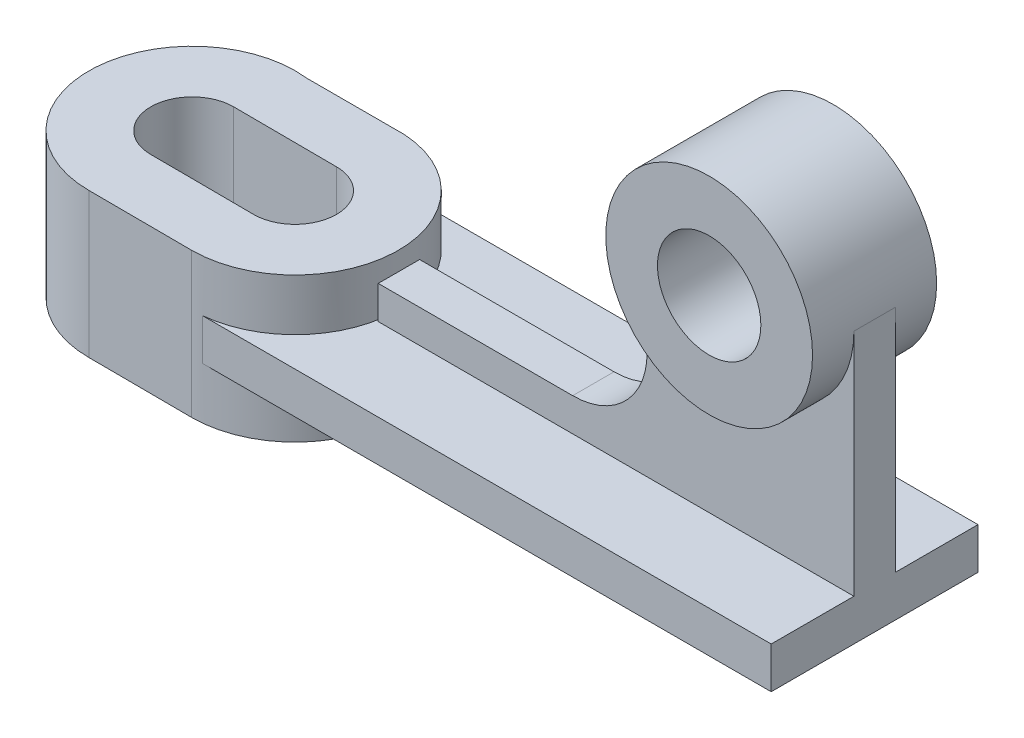
from build123d import *

# Parameters (mm, degrees)
SKETCH1_W                 = 140
SKETCH1_H                 = 50
BOSS_EXTRUDE1_DEPTH       = 10
BOSS_EXTRUDE2_START       = -12.5
BOSS_EXTRUDE2_DEPTH       = 35
CUT_EXTRUDE1_DEPTH        = 50
BOSS_EXTRUDE8_DEPTH       = 5
BOSS_EXTRUDE9_START       = -18.443977
BOSS_EXTRUDE9_OUTLINE_R   = 25
BOSS_EXTRUDE9_OUTLINE_R_2 = 12.5
BOSS_EXTRUDE9_DEPTH       = 30
FILLET1_R                 = 18
CUT_EXTRUDE2_START        = -30
CUT_EXTRUDE2_DEPTH        = 30


# Read off the part's stored shape, not the designer's step: Boss-Extrude2, Boss-Extrude9
with BuildPart() as part:
    # Sketch1 → Boss-Extrude1 (new body)
    with BuildSketch(Plane(origin=(0, 0, 0), x_dir=(1, 0, 0), z_dir=(0, 1, 0))):
        with Locations((17.140882, 3.443977)):
            Rectangle(SKETCH1_W, SKETCH1_H)
    extrude(amount=BOSS_EXTRUDE1_DEPTH)

    # Boss-Extrude2 outline → Boss-Extrude2 (add)
    with BuildSketch(Plane(origin=(0, 0, 0), x_dir=(1, 0, 0), z_dir=(0, 1, 0)).offset(BOSS_EXTRUDE2_START)):
        with BuildLine():
            Line((-51.363996, 28.275018), (-52.859118, 28.275018))
            Line((-52.859118, 28.275018), (-74.973336, 28.275018))
            ThreePointArc((-74.973336, 28.275018), (-102.814942, 4.885934), (-77.856685, -21.558151))
            Line((-77.856685, -21.558151), (-52.858882, -21.680248))
            ThreePointArc((-52.858882, -21.680248), (-27.870068, 2.571974), (-51.363996, 28.275018))
        make_face()
        with BuildLine():
            Line((-52.859118, 13.319754), (-52.858882, 13.319753))
            ThreePointArc((-52.858882, 13.319753), (-42.85888, 3.319752), (-52.858882, -6.68025))
            Line((-52.858882, -6.68025), (-52.859118, -6.680248))
            Line((-52.859118, -6.680248), (-77.856685, -6.558153))
            ThreePointArc((-77.856685, -6.558153), (-87.856686, 3.441849), (-77.856685, 13.44185))
            Line((-77.856685, 13.44185), (-52.859118, 13.319754))
        make_face(mode=Mode.SUBTRACT)
    extrude(amount=BOSS_EXTRUDE2_DEPTH)

    # Sketch2 → Cut-Extrude1 (cut)
    with BuildSketch(Plane(origin=(0, 10, 0), x_dir=(1, 0, 0), z_dir=(0, 1, 0))):
        with BuildLine():
            Line((-52.859118, 13.319753), (-52.859118, -6.68025))
            ThreePointArc((-52.859118, -6.68025), (-42.859116, 3.319752), (-52.859118, 13.319753))
        make_face()
    extrude(amount=-CUT_EXTRUDE1_DEPTH, mode=Mode.SUBTRACT)

    # 3DSketch2 → Boss-Extrude8 (add, symmetric)
    with BuildSketch(Plane(origin=(87.140882, 10, -3.443977), x_dir=(-0.9975892937431798, 0.0693945315495666, 0), z_dir=(0, 0, -1))):
        Polygon((0, 0), (114.733361, -7.981108), (115.288545, 0), (50.434648, 4.511381), (53.730889, 51.896873), (3.851424, 55.366599), align=None)
    extrude(amount=BOSS_EXTRUDE8_DEPTH, both=True)

    # Boss-Extrude9 outline → Boss-Extrude9 (add)
    with BuildSketch(Plane.XY.offset(BOSS_EXTRUDE9_START)):
        with Locations((62.140882, 65.500395)):
            Circle(BOSS_EXTRUDE9_OUTLINE_R)
        with Locations((62.140882, 65.500395)):
            Circle(BOSS_EXTRUDE9_OUTLINE_R_2, mode=Mode.SUBTRACT)
    extrude(amount=BOSS_EXTRUDE9_DEPTH)

    # Fillet1
    fillet1_edges = [part.edges().sort_by_distance(p)[0] for p in [
        (37.140882, 18.000395, -3.443977),
    ]]
    fillet(fillet1_edges, radius=FILLET1_R)

    # Sketch3 → Cut-Extrude2 (cut)
    with BuildSketch(Plane.XY.offset(1.556023).offset(CUT_EXTRUDE2_START)):
        with BuildLine():
            Line((74.640882, 65.500395), (49.640882, 65.500395))
            ThreePointArc((49.640882, 65.500395), (62.140882, 53.000395), (74.640882, 65.500395))
        make_face()
    extrude(amount=CUT_EXTRUDE2_DEPTH, mode=Mode.SUBTRACT)


solid = part.part
